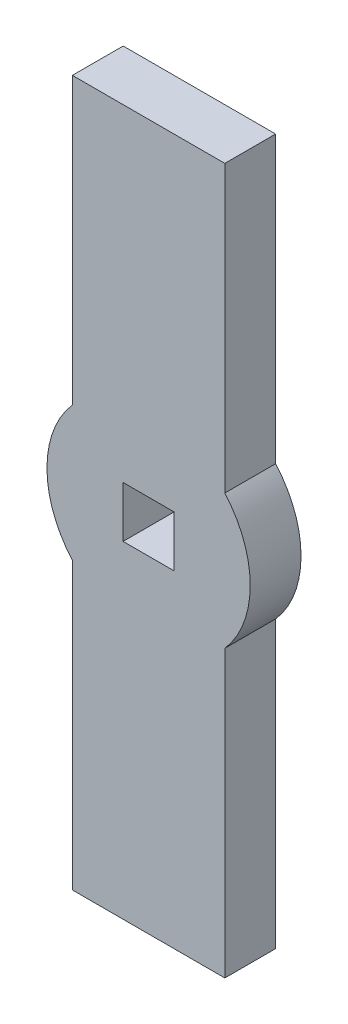
from build123d import *

# Parameters (mm, degrees)
SKETCH2_R           = 2.032
BOSS_EXTRUDE1_DEPTH = 6.35
SKETCH3_W           = 6.38
SKETCH3_H           = 6.38
CUT_EXTRUDE1_DEPTH  = 47.314564472


with BuildPart() as part:
    # Sketch2 → Boss-Extrude1 (new body)
    with BuildSketch(Plane.XY):
        with BuildLine():
            Line((-9.525, 8.400260413), (-9.525, 44.084309933))
            Line((-9.525, 44.084309933), (9.525, 44.084309933))
            Line((9.525, 44.084309933), (9.525, 8.400260413))
            ThreePointArc((9.525, 8.400260413), (12.7, 0), (9.525, -8.400260413))
            Line((9.525, -8.400260413), (9.525, -44.084309933))
            Line((9.525, -44.084309933), (-9.525, -44.084309933))
            Line((-9.525, -44.084309933), (-9.525, -8.400260413))
            ThreePointArc((-9.525, -8.400260413), (-12.7, 0), (-9.525, 8.400260413))
        make_face()
        Circle(SKETCH2_R, mode=Mode.SUBTRACT)
    extrude(amount=BOSS_EXTRUDE1_DEPTH)

    # Sketch3 → Cut-Extrude1 (cut, through all)
    with BuildSketch(Plane(origin=(0, 0, 0), x_dir=(-1, 0, 0), z_dir=(0, 0, -1))):
        Rectangle(SKETCH3_W, SKETCH3_H)
    extrude(amount=-CUT_EXTRUDE1_DEPTH, mode=Mode.SUBTRACT)


solid = part.part
